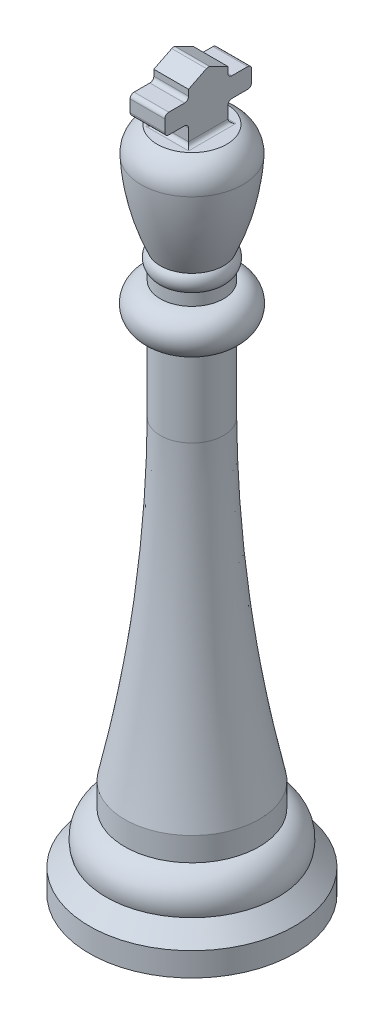
from build123d import *

# Parameters (mm, degrees)
SKETCH3_W           = 2.234278516
SKETCH3_H           = 3.869883908
BOSS_EXTRUDE1_DEPTH = 3.81
SKETCH4_W           = 2.234278516
SKETCH4_H           = 3.81
BOSS_EXTRUDE2_DEPTH = 1.27
SKETCH7_W           = 2.234278516
SKETCH7_H           = 3.81
BOSS_EXTRUDE3_DEPTH = 1.27
CUT_EXTRUDE3_DEPTH  = 2.286
FILLET1_R           = 0.254


with BuildPart() as part:
    # Sketch1 → Revolve1 (revolve)
    with BuildSketch(Plane.XY):
        with BuildLine():
            Line((0, 0), (6.604, 0))
            Line((6.604, 0), (6.604, 1.524))
            Line((6.604, 1.524), (5.526369265, 2.601630735))
            ThreePointArc((5.526369265, 2.601630735), (5.382745309, 3.954852613), (4.324315469, 4.810167506))
            Line((4.324315469, 4.810167506), (4.324315469, 6.334167506))
            add(Edge.make_bspline(
                [(4.324315469, 6.334167506), (2.100443134, 16.314762025), (2.037352116, 26.594780959)],
                knots=[0, 0, 0, 1, 1, 1], degree=2))
            Line((2.037352116, 26.594780959), (2.037352116, 31.674780959))
            ThreePointArc((2.037352116, 31.674780959), (3.307352116, 32.944780959), (2.037352116, 34.214780959))
            Line((2.037352116, 34.214780959), (2.037352116, 34.976780959))
            ThreePointArc((2.037352116, 34.976780959), (2.260536748, 35.515596327), (2.037352116, 36.054411694))
            add(Edge.make_bspline(
                [(2.037352116, 36.054411694), (2.754588802, 37.690610821), (3.171523279, 39.41712427), (3.279734912, 41.196512193)],
                knots=[0, 0, 0, 0, 0.825528863, 0.825528863, 0.825528863, 0.825528863], degree=3))
            ThreePointArc((3.279734912, 41.196512193), (3.026614336, 42.224230944), (2.234278516, 42.926))
            Line((2.234278516, 42.926), (0, 42.926))
            Line((0, 42.926), (0, 0))
        make_face()
    revolve(axis=Axis((0, 0, 0), (0, 1, 0)))

    # Sketch3 → Boss-Extrude1 (add)
    with BuildSketch(Plane(origin=(0, 42.926, 0), x_dir=(1, 0, 0), z_dir=(0, 1, 0))):
        Rectangle(SKETCH3_W, SKETCH3_H)
    extrude(amount=BOSS_EXTRUDE1_DEPTH)

    # Sketch4 → Boss-Extrude2 (add)
    with BuildSketch(Plane(origin=(0, 0, -1.934941954), x_dir=(-1, 0, 0), z_dir=(0, 0, -1))):
        with Locations((0, 44.831)):
            Rectangle(SKETCH4_W, SKETCH4_H)
    extrude(amount=BOSS_EXTRUDE2_DEPTH)

    # Sketch7 → Boss-Extrude3 (add)
    with BuildSketch(Plane.XY.offset(1.934941954)):
        with Locations((0, 44.831)):
            Rectangle(SKETCH7_W, SKETCH7_H)
    extrude(amount=BOSS_EXTRUDE3_DEPTH)

    # Sketch11 → Cut-Extrude3 (cut)
    with BuildSketch(Plane(origin=(1.117139258, 0, 0), x_dir=(0, 0, -1), z_dir=(1, 0, 0))):
        with BuildLine():
            Line((-1.33813329, 42.926), (-1.33813329, 43.942))
            ThreePointArc((-1.33813329, 43.942), (-1.412528167, 44.121605122), (-1.59213329, 44.196))
            Line((-1.59213329, 44.196), (-2.60813329, 44.196))
            ThreePointArc((-2.60813329, 44.196), (-2.787738412, 44.270394878), (-2.86213329, 44.45))
            Line((-2.86213329, 44.45), (-2.86213329, 45.212))
            ThreePointArc((-2.86213329, 45.212), (-2.787738412, 45.391605122), (-2.60813329, 45.466))
            Line((-2.60813329, 45.466), (-1.59213329, 45.466))
            ThreePointArc((-1.59213329, 45.466), (-1.412528167, 45.540394878), (-1.33813329, 45.72))
            Line((-1.33813329, 45.72), (-1.33813329, 46.10618983))
            Line((-1.33813329, 46.10618983), (-0.180981014, 46.680037288))
            ThreePointArc((-0.180981014, 46.680037288), (-0.06813329, 46.706482039), (0.044714435, 46.680037288))
            Line((0.044714435, 46.680037288), (1.20186671, 46.10618983))
            Line((1.20186671, 46.10618983), (1.20186671, 45.72))
            ThreePointArc((1.20186671, 45.72), (1.276261588, 45.540394878), (1.45586671, 45.466))
            Line((1.45586671, 45.466), (2.47186671, 45.466))
            ThreePointArc((2.47186671, 45.466), (2.651471833, 45.391605122), (2.72586671, 45.212))
            Line((2.72586671, 45.212), (2.72586671, 44.45))
            ThreePointArc((2.72586671, 44.45), (2.651471833, 44.270394878), (2.47186671, 44.196))
            Line((2.47186671, 44.196), (1.45586671, 44.196))
            ThreePointArc((1.45586671, 44.196), (1.276261588, 44.121605122), (1.20186671, 43.942))
            Line((1.20186671, 43.942), (1.20186671, 42.926))
            Line((1.20186671, 42.926), (3.204941954, 42.926))
            Line((3.204941954, 42.926), (3.204941954, 46.736))
            Line((3.204941954, 46.736), (-3.204941954, 46.736))
            Line((-3.204941954, 46.736), (-3.204941954, 42.926))
            Line((-3.204941954, 42.926), (-1.33813329, 42.926))
        make_face()
    extrude(amount=-CUT_EXTRUDE3_DEPTH, mode=Mode.SUBTRACT)

    # Fillet1
    fillet1_edges = [part.edges().sort_by_distance(p)[0] for p in [
        (0, 42.926, -1.20186671),
        (1.117139258, 42.926, 0.06813329),
        (-1.117139258, 42.926, 0.06813329),
        (0, 42.926, 1.33813329),
    ]]
    fillet(fillet1_edges, radius=FILLET1_R)


solid = part.part
